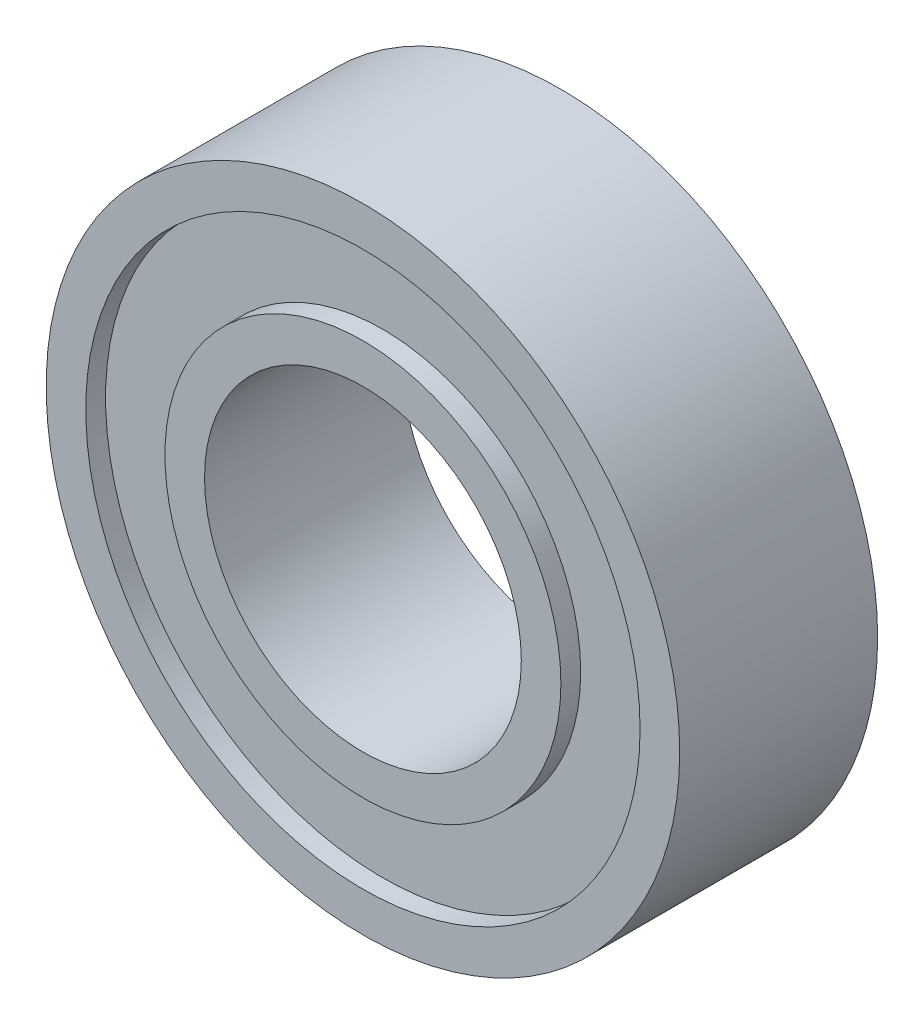
from build123d import *

# Parameters (mm, degrees)
ESQUISSE1_R             = 8
ESQUISSE1_R_2           = 7
BOSS_EXTRU_1_DEPTH      = 5
ESQUISSE1_3_R           = 7
ESQUISSE1_3_R_2         = 5
BOSS_EXTRU_2_DEPTH      = 4.5
ESQUISSE1_4_R           = 5
ESQUISSE1_4_R_2         = 4
BOSS_EXTRU_3_DEPTH      = 5
ESQUISSE2_R             = 7
ESQUISSE2_R_2           = 5
ENL_V_MAT_EXTRU_2_DEPTH = 0.5


with BuildPart() as part:
    # Esquisse1 → Boss.-Extru.1 (new body)
    with BuildSketch(Plane.XY):
        Circle(ESQUISSE1_R)
        Circle(ESQUISSE1_R_2, mode=Mode.SUBTRACT)
    extrude(amount=BOSS_EXTRU_1_DEPTH)

    # Esquisse1<3> → Boss.-Extru.2 (add)
    with BuildSketch(Plane.XY):
        Circle(ESQUISSE1_3_R)
        Circle(ESQUISSE1_3_R_2, mode=Mode.SUBTRACT)
    extrude(amount=BOSS_EXTRU_2_DEPTH)

    # Esquisse1<4> → Boss.-Extru.3 (add)
    with BuildSketch(Plane.XY):
        Circle(ESQUISSE1_4_R)
        Circle(ESQUISSE1_4_R_2, mode=Mode.SUBTRACT)
    extrude(amount=BOSS_EXTRU_3_DEPTH)

    # Esquisse2 → Enlèv. mat.-Extru.2 (cut)
    with BuildSketch(Plane(origin=(0, 0, 0), x_dir=(-1, 0, 0), z_dir=(0, 0, -1))):
        Circle(ESQUISSE2_R)
        Circle(ESQUISSE2_R_2, mode=Mode.SUBTRACT)
    extrude(amount=-ENL_V_MAT_EXTRU_2_DEPTH, mode=Mode.SUBTRACT)


solid = part.part
